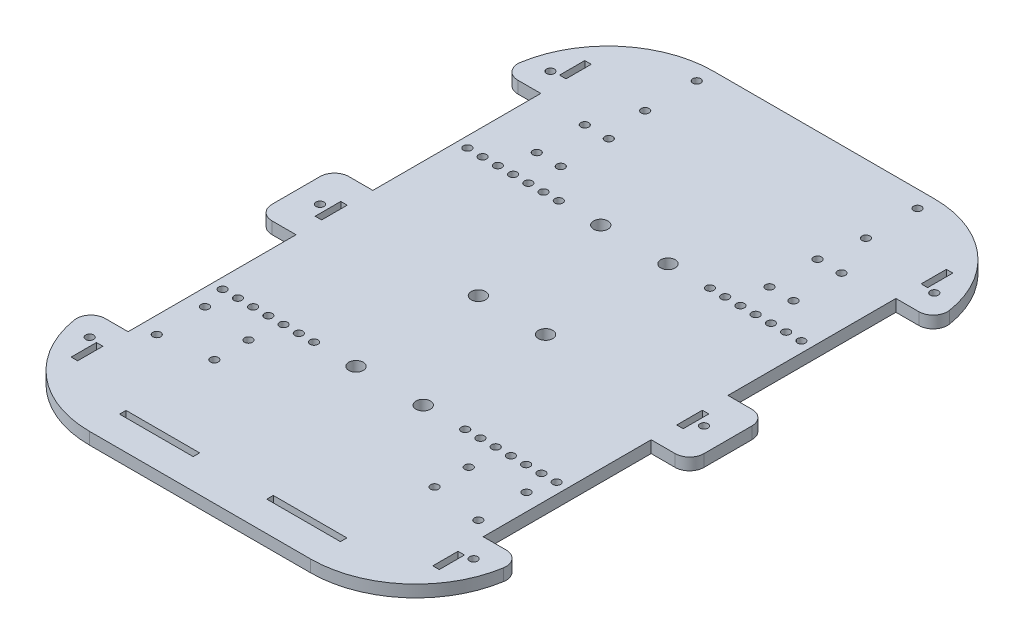
from build123d import *

# Parameters (mm, degrees)
SKETCH2_W           = 2.7
SKETCH2_H           = 10.51
SKETCH2_H_2         = 10.666666666
SKETCH2_W_2         = 30.68
SKETCH2_H_3         = 2.7
BOSS_EXTRUDE4_DEPTH = 5
SKETCH5_R           = 1.65
SKETCH5_R_2         = 3
CUT_EXTRUDE1_DEPTH  = 159.192920196


with BuildPart() as part:
    # Sketch2 → Boss-Extrude4 (new body)
    with BuildSketch(Plane(origin=(0, 0, 0), x_dir=(1, 0, 0), z_dir=(0, 1, 0))):
        with BuildLine():
            Line((46, -130), (-46, -130))
            ThreePointArc((-46, -130), (-74.550970119, -119.478980051), (-89.448061775, -92.947368421))
            ThreePointArc((-89.448061775, -92.947368421), (-88.08864154, -88.106685893), (-83.523326079, -86))
            Line((-83.523326079, -86), (-74, -86))
            Line((-74, -86), (-74, -16))
            Line((-74, -16), (-84, -16))
            ThreePointArc((-84, -16), (-88.242640687, -14.242640687), (-90, -10))
            Line((-90, -10), (-90, 10))
            ThreePointArc((-90, 10), (-88.242640687, 14.242640687), (-84, 16))
            Line((-84, 16), (-74, 16))
            Line((-74, 16), (-74, 86))
            Line((-74, 86), (-83.523326079, 86))
            ThreePointArc((-83.523326079, 86), (-88.08864154, 88.106685893), (-89.448061775, 92.947368421))
            ThreePointArc((-89.448061775, 92.947368421), (-74.550970119, 119.478980051), (-46, 130))
            Line((-46, 130), (46, 130))
            ThreePointArc((46, 130), (74.550970119, 119.478980051), (89.448061775, 92.947368421))
            ThreePointArc((89.448061775, 92.947368421), (88.08864154, 88.106685893), (83.523326079, 86))
            Line((83.523326079, 86), (74, 86))
            Line((74, 86), (74, 16))
            Line((74, 16), (84, 16))
            ThreePointArc((84, 16), (88.242640687, 14.242640687), (90, 10))
            Line((90, 10), (90, -10))
            ThreePointArc((90, -10), (88.242640687, -14.242640687), (84, -16))
            Line((84, -16), (74, -16))
            Line((74, -16), (74, -86))
            Line((74, -86), (83.523326079, -86))
            ThreePointArc((83.523326079, -86), (88.08864154, -88.106685893), (89.448061775, -92.947368421))
            ThreePointArc((89.448061775, -92.947368421), (74.550970119, -119.478980051), (46, -130))
        make_face()
        with Locations((-75.35, 101.765)):
            Rectangle(SKETCH2_W, SKETCH2_H, mode=Mode.SUBTRACT)
        with Locations((75.35, 101.765)):
            Rectangle(SKETCH2_W, SKETCH2_H, mode=Mode.SUBTRACT)
        with Locations((75.35, -101.765)):
            Rectangle(SKETCH2_W, SKETCH2_H, mode=Mode.SUBTRACT)
        with Locations((-75.35, -101.765)):
            Rectangle(SKETCH2_W, SKETCH2_H, mode=Mode.SUBTRACT)
        with Locations((-75.35, 0)):
            Rectangle(SKETCH2_W, SKETCH2_H_2, mode=Mode.SUBTRACT)
        with Locations((75.35, 0)):
            Rectangle(SKETCH2_W, SKETCH2_H_2, mode=Mode.SUBTRACT)
        with Locations((30.68, -116.18)):
            Rectangle(SKETCH2_W_2, SKETCH2_H_3, mode=Mode.SUBTRACT)
        with Locations((-30.68, -116.18)):
            Rectangle(SKETCH2_W_2, SKETCH2_H_3, mode=Mode.SUBTRACT)
    extrude(amount=BOSS_EXTRUDE4_DEPTH)

    # Sketch5 → Cut-Extrude1 (cut, through all)
    with BuildSketch(Plane(origin=(0, 5, 0), x_dir=(1, 0, 0), z_dir=(0, 1, 0))):
        with Locations((-69.6, -51)):
            Circle(SKETCH5_R)
        with Locations((-63.25, -51)):
            Circle(SKETCH5_R)
        with Locations((-56.9, -51)):
            Circle(SKETCH5_R)
        with Locations((-50.55, -51)):
            Circle(SKETCH5_R)
        with Locations((-44.2, -51)):
            Circle(SKETCH5_R)
        with Locations((-37.85, -51)):
            Circle(SKETCH5_R)
        with Locations((-31.5, -51)):
            Circle(SKETCH5_R)
        with Locations((31.5, -51)):
            Circle(SKETCH5_R)
        with Locations((37.85, -51)):
            Circle(SKETCH5_R)
        with Locations((44.2, -51)):
            Circle(SKETCH5_R)
        with Locations((50.55, -51)):
            Circle(SKETCH5_R)
        with Locations((56.9, -51)):
            Circle(SKETCH5_R)
        with Locations((63.25, -51)):
            Circle(SKETCH5_R)
        with Locations((69.6, -51)):
            Circle(SKETCH5_R)
        with Locations((69.6, 51)):
            Circle(SKETCH5_R)
        with Locations((63.25, 51)):
            Circle(SKETCH5_R)
        with Locations((56.9, 51)):
            Circle(SKETCH5_R)
        with Locations((50.55, 51)):
            Circle(SKETCH5_R)
        with Locations((44.2, 51)):
            Circle(SKETCH5_R)
        with Locations((37.85, 51)):
            Circle(SKETCH5_R)
        with Locations((31.5, 51)):
            Circle(SKETCH5_R)
        with Locations((-31.5, 51)):
            Circle(SKETCH5_R)
        with Locations((-37.85, 51)):
            Circle(SKETCH5_R)
        with Locations((-44.2, 51)):
            Circle(SKETCH5_R)
        with Locations((-50.55, 51)):
            Circle(SKETCH5_R)
        with Locations((-56.9, 51)):
            Circle(SKETCH5_R)
        with Locations((-63.25, 51)):
            Circle(SKETCH5_R)
        with Locations((-69.6, 51)):
            Circle(SKETCH5_R)
        with Locations((-14, -51)):
            Circle(SKETCH5_R_2)
        with Locations((14, -51)):
            Circle(SKETCH5_R_2)
        with Locations((14, 51)):
            Circle(SKETCH5_R_2)
        with Locations((-14, 51)):
            Circle(SKETCH5_R_2)
        with Locations((-14, 0)):
            Circle(SKETCH5_R_2)
        with Locations((14, 0)):
            Circle(SKETCH5_R_2)
        with Locations((-80, 96)):
            Circle(SKETCH5_R)
        with Locations((-80, 0)):
            Circle(SKETCH5_R)
        with Locations((80, 0)):
            Circle(SKETCH5_R)
        with Locations((-80, -96)):
            Circle(SKETCH5_R)
        with Locations((80, -96)):
            Circle(SKETCH5_R)
        with Locations((80, 96)):
            Circle(SKETCH5_R)
        with Locations((-53.5, 83.83)):
            Circle(SKETCH5_R)
        with Locations((-53.5, 63.83)):
            Circle(SKETCH5_R)
        with Locations((-43.5, 63.83)):
            Circle(SKETCH5_R)
        with Locations((-43.5, 83.83)):
            Circle(SKETCH5_R)
        with Locations((43.5, 63.83)):
            Circle(SKETCH5_R)
        with Locations((53.5, 63.83)):
            Circle(SKETCH5_R)
        with Locations((43.5, 83.83)):
            Circle(SKETCH5_R)
        with Locations((53.5, 83.83)):
            Circle(SKETCH5_R)
        with Locations((-46, 123)):
            Circle(SKETCH5_R)
        with Locations((-46, 101.5)):
            Circle(SKETCH5_R)
        with Locations((46, 101.5)):
            Circle(SKETCH5_R)
        with Locations((46, 123)):
            Circle(SKETCH5_R)
        with Locations((-67, -60.960027583)):
            Circle(SKETCH5_R)
        with Locations((-45.897115189, -63.923125828)):
            Circle(SKETCH5_R)
        with Locations((-67, -81.039972417)):
            Circle(SKETCH5_R)
        with Locations((-45.897115189, -78.156819007)):
            Circle(SKETCH5_R)
        with Locations((45.897115189, -63.923125828)):
            Circle(SKETCH5_R)
        with Locations((45.897115189, -78.156819007)):
            Circle(SKETCH5_R)
        with Locations((67, -81.039972417)):
            Circle(SKETCH5_R)
        with Locations((67, -60.960027583)):
            Circle(SKETCH5_R)
    extrude(amount=-CUT_EXTRUDE1_DEPTH, mode=Mode.SUBTRACT)


solid = part.part
